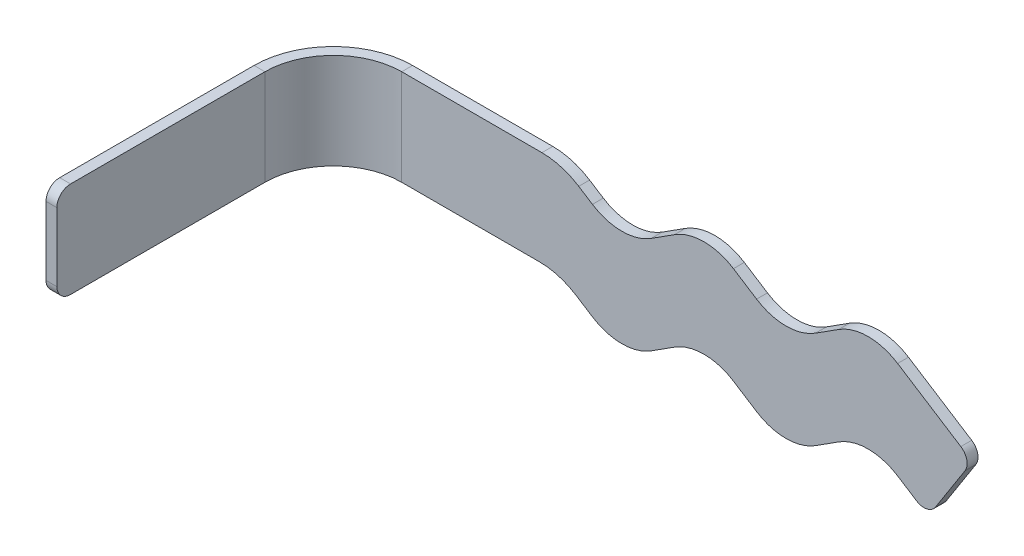
from build123d import *

# Parameters (mm, degrees)
BOSS_EXTRUDE1_DEPTH          = 1.5875
FILLET3_R                    = 8
FILLET4_R                    = 8
BOSS_EXTRUDE3_DEPTH          = 1.5875
EDGE_FLANGE1_STRIP_W         = 26.35
EDGE_FLANGE1_STRIP_H         = 1.5875
EDGE_FLANGE1_STRIP_CUT_DEPTH = 14
EDGE_FLANGE1_DEPTH           = 14
FILLET5_R                    = 10
FILLET9_R                    = 2


# Sheet-metal steps are written as plain solids
with BuildPart() as part:
    # Sketch3 → Boss-Extrude1 (new body)
    with BuildSketch(Plane.XY):
        Polygon((58.775, 33.228336454), (53.202823644, 29.668334894), (46.775, 25.561669788), (40.347176356, 29.668334894), (34.775, 33.228336454), (22.775, 25.561669788), (14.005335663, 31.164510892), (7.544664337, 21.052155774), (22.775, 11.321663546), (28.347176356, 14.881665106), (34.775, 18.988330212), (41.202823644, 14.881665106), (46.775, 11.321663546), (58.775, 18.988330212), (67.544664337, 13.385489108), (74.005335663, 23.497844226), align=None)
    extrude(amount=BOSS_EXTRUDE1_DEPTH)

    # Fillet3
    fillet3_edges = [part.edges().sort_by_distance(p)[0] for p in [
        (46.775, 11.321663546, 0.79375),
        (22.775, 11.321663546, 0.79375),
        (34.775, 33.228336454, 0.79375),
        (58.775, 33.228336454, 0.79375),
    ]]
    fillet(fillet3_edges, radius=FILLET3_R)

    # Fillet4
    fillet4_edges = [part.edges().sort_by_distance(p)[0] for p in [
        (34.775, 18.988330212, 0.79375),
        (22.775, 25.561669788, 0.79375),
        (46.775, 25.561669788, 0.79375),
        (58.775, 18.988330212, 0.79375),
    ]]
    fillet(fillet4_edges, radius=FILLET4_R)

    # Sketch5 → Boss-Extrude3 (add)
    with BuildSketch(Plane(origin=(0, 0, 0), x_dir=(-1, 0, 0), z_dir=(0, 0, -1))):
        Polygon((20.994664337, 31.164510892), (-14.005335663, 31.164510892), (-7.544664337, 21.052155774), (-13.629673718, 17.164510892), (20.994664337, 17.164510892), align=None)
    extrude(amount=-BOSS_EXTRUDE3_DEPTH)

    # Edge-Flange1 strip (across the edge) → Edge-Flange1 strip cut (cut)
    with BuildSketch(Plane(origin=(-20.994664337, 31.164510892, 1.5875), x_dir=(1, 0, 0), z_dir=(0, -1, 0))):
        with Locations((-1.5875, -0.79375)):
            Rectangle(EDGE_FLANGE1_STRIP_W, EDGE_FLANGE1_STRIP_H)
    extrude(amount=EDGE_FLANGE1_STRIP_CUT_DEPTH, mode=Mode.SUBTRACT)

    # Edge-Flange1 section (across the edge) → Edge-Flange1 (add)
    with BuildSketch(Plane(origin=(-20.994664337, 31.164510892, 1.5875), x_dir=(1, 0, 0), z_dir=(0, -1, 0))):
        with BuildLine():
            Line((0, 10), (0, 40.4125))
            Line((0, 40.4125), (1.5875, 40.4125))
            Line((1.5875, 40.4125), (1.5875, 10))
            ThreePointArc((1.5875, 10), (4.516432188, 2.928932188), (11.5875, 0))
            Line((11.5875, 0), (11.5875, -1.5875))
            ThreePointArc((11.5875, -1.5875), (3.393900173, 1.806400173), (0, 10))
        make_face()
    extrude(amount=EDGE_FLANGE1_DEPTH)

    # Fillet5
    fillet5_edges = [part.edges().sort_by_distance(p)[0] for p in [
        (14.005335663, 31.164510892, 0.79375),
        (13.629673718, 17.164510892, 0.79375),
    ]]
    fillet(fillet5_edges, radius=FILLET5_R)

    # Fillet9
    fillet9_edges = [part.edges().sort_by_distance(p)[0] for p in [
        (67.544664337, 13.385489108, 0.79375),
        (74.005335663, 23.497844226, 0.79375),
        (-20.200914337, 31.164510892, 42),
        (-20.200914337, 17.164510892, 42),
    ]]
    fillet(fillet9_edges, radius=FILLET9_R)


solid = part.part
